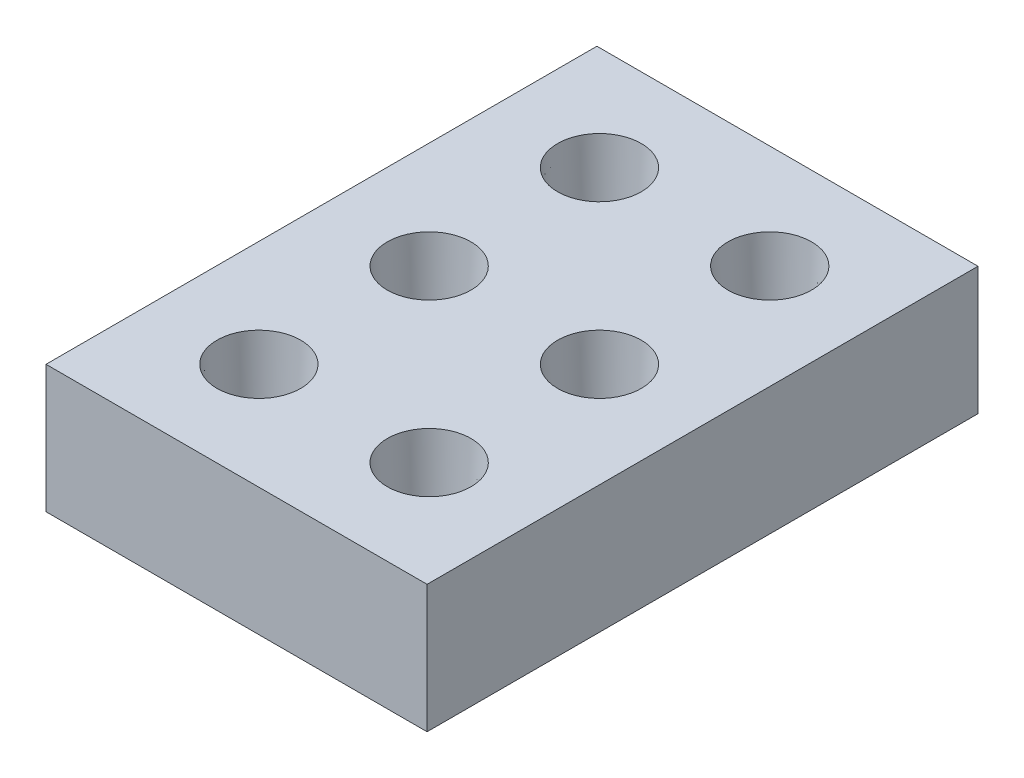
from build123d import *

# Parameters (mm, degrees)
SKETCH1_W            = 17.902420718
SKETCH1_H            = 25.880604579
BOSS_EXTRUDE1_DEPTH  = 6
LPATTERN1_COUNT      = 3
LPATTERN1_PITCH      = 8
LPATTERN1_COUNT_DIR2 = 2
LPATTERN1_PITCH_DIR2 = 8


with BuildPart() as part:
    # Sketch1 → Boss-Extrude1 (new body)
    with BuildSketch(Plane(origin=(0, 0, 0), x_dir=(1, 0, 0), z_dir=(0, 1, 0))):
        with Locations((3.951210359, 12.940302289)):
            Rectangle(SKETCH1_W, SKETCH1_H)
    extrude(amount=BOSS_EXTRUDE1_DEPTH)

    # Sketch3 → Cut-Revolve1 (revolve, cut)
    with BuildSketch(Plane.ZY):
        Polygon((-5, 6), (-5, 0), (-6.77, 0), (-6.77, 3.2), (-6.965795073, 6), align=None)
    cut_revolve1 = revolve(axis=Axis((0, 6, -5), (0, -1, 0)), mode=Mode.SUBTRACT)

    # LPattern1: Cut-Revolve1 3 × 2
    with Locations(*[(j * LPATTERN1_PITCH_DIR2, 0, -i * LPATTERN1_PITCH) for i in range(LPATTERN1_COUNT) for j in range(LPATTERN1_COUNT_DIR2) if (i, j) != (0, 0)]):
        add(cut_revolve1, mode=Mode.SUBTRACT)


solid = part.part
